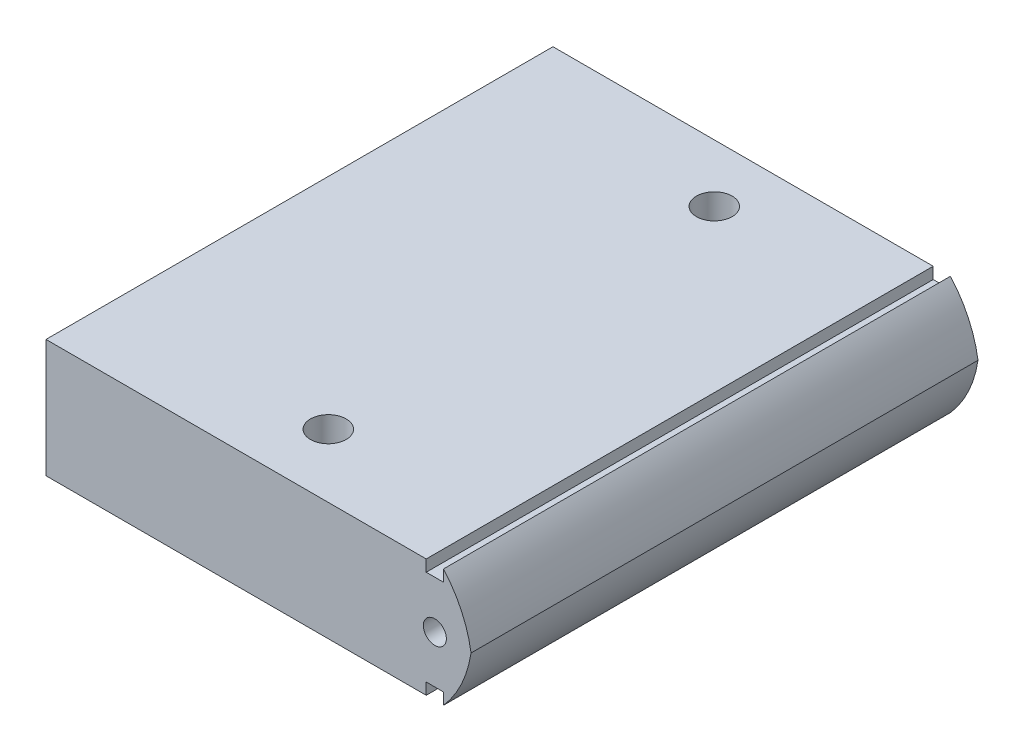
from build123d import *

# Parameters (mm, degrees)
CROQUIS1_W              = 37
CROQUIS1_H              = 44
SALIENTE_EXTRUIR1_DEPTH = 10.25
CROQUIS2_R              = 1.55
CORTAR_EXTRUIR1_DEPTH   = 10.25
CROQUIS3_W              = 1.5
CROQUIS3_H              = 44
CORTAR_EXTRUIR2_DEPTH   = 1
CROQUIS4_W              = 1.5
CROQUIS4_H              = 44
CORTAR_EXTRUIR3_DEPTH   = 1
CROQUIS5_R              = 1
CORTAR_EXTRUIR4_DEPTH   = 44
CROQUIS6_W              = 22
CROQUIS6_H              = 5
CORTAR_EXTRUIR5_DEPTH   = 5
REDONDEO1_R             = 10


with BuildPart() as part:
    # Croquis1 → Saliente-Extruir1 (new body)
    with BuildSketch(Plane(origin=(0, 0, 0), x_dir=(1, 0, 0), z_dir=(0, 1, 0))):
        with Locations((18.5, 22)):
            Rectangle(CROQUIS1_W, CROQUIS1_H)
    extrude(amount=SALIENTE_EXTRUIR1_DEPTH)

    # Croquis2 → Cortar-Extruir1 (cut)
    with BuildSketch(Plane(origin=(0, 10.25, 0), x_dir=(1, 0, 0), z_dir=(0, 1, 0))):
        with Locations(Location((19, 39, 0), (0, 0, 270))):
            Circle(CROQUIS2_R)
        with Locations(Location((19, 5.5, 0), (0, 0, 270))):
            Circle(CROQUIS2_R)
    extrude(amount=-CORTAR_EXTRUIR1_DEPTH, mode=Mode.SUBTRACT)

    # Croquis3 → Cortar-Extruir2 (cut)
    with BuildSketch(Plane(origin=(0, 10.25, 0), x_dir=(1, 0, 0), z_dir=(0, 1, 0))):
        with Locations((33.75, 22)):
            Rectangle(CROQUIS3_W, CROQUIS3_H)
    extrude(amount=-CORTAR_EXTRUIR2_DEPTH, mode=Mode.SUBTRACT)

    # Croquis4 → Cortar-Extruir3 (cut)
    with BuildSketch(Plane.XZ):
        with Locations((33.75, -22)):
            Rectangle(CROQUIS4_W, CROQUIS4_H)
    extrude(amount=-CORTAR_EXTRUIR3_DEPTH, mode=Mode.SUBTRACT)

    # Croquis5 → Cortar-Extruir4 (cut)
    with BuildSketch(Plane(origin=(0, 0, -44), x_dir=(-1, 0, 0), z_dir=(0, 0, -1))):
        with Locations((-33.75, 5.125)):
            Circle(CROQUIS5_R)
    extrude(amount=-CORTAR_EXTRUIR4_DEPTH, mode=Mode.SUBTRACT)

    # Croquis6 → Cortar-Extruir5 (cut)
    with BuildSketch(Plane.ZY):
        with Locations((-23, 6.75)):
            Rectangle(CROQUIS6_W, CROQUIS6_H)
    extrude(amount=-CORTAR_EXTRUIR5_DEPTH, mode=Mode.SUBTRACT)

    # Redondeo1
    # the kernel refuses this fillet: 10 mm, written as the material it takes off along each edge
    with BuildSketch(Plane(origin=(37, 0, 16.535945694), x_dir=(-1, 0, 0), z_dir=(0, 0, -1))) as redondeo1_piece_1:
        with BuildLine():
            CenterArc((10, 6.614378278), REDONDEO1_R, 180, 41.409622109)
            Line((0, 6.614378278), (-0.2, 6.614378278))
            Line((-0.2, 6.614378278), (-0.2, 0))
            Line((-0.2, 0), (0, -0.2))
            ThreePointArc((0, -0.2), (1.25, -0.2), (2.35, -0.132287566))
            Line((2.35, -0.132287566), (2.5, 0))
        make_face()
    extrude(amount=77.071891388, mode=Mode.SUBTRACT)
    with BuildSketch(Plane(origin=(37, 10.25, 16.535945694), x_dir=(0, -1, 0), z_dir=(0, 0, -1))) as redondeo1_piece_2:
        with BuildLine():
            CenterArc((6.614378278, 10), REDONDEO1_R, 228.590377891, 41.409622109)
            Line((0, 2.5), (-0.132287566, 2.35))
            ThreePointArc((-0.132287566, 2.35), (-0.2, 1.25), (-0.2, 0))
            Line((-0.2, 0), (0, -0.2))
            Line((0, -0.2), (6.614378278, -0.2))
            Line((6.614378278, -0.2), (6.614378278, 0))
        make_face()
    extrude(amount=77.071891388, mode=Mode.SUBTRACT)


solid = part.part
